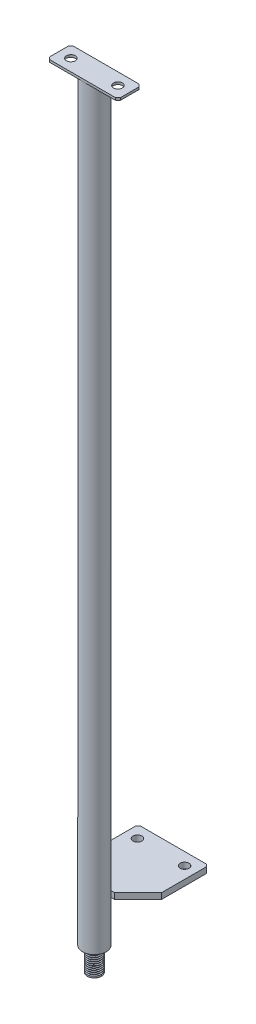
from build123d import *

# Parameters (mm, degrees)
SKETCH1_R           = 12.7
SKETCH1_R_2         = 7.62
BOSS_EXTRUDE1_DEPTH = 812.8
BOSS_EXTRUDE2_START = 38.1
SKETCH2_R           = 7.62
BOSS_EXTRUDE2_DEPTH = 38.1
THREAD1_PITCH       = 1.953846154
BOSS_EXTRUDE4_START = 6.35
BOSS_EXTRUDE4_DEPTH = 6.35
CUT_EXTRUDE2_REACH  = 769.692
SKETCH11_R          = 4.7625
SKETCH12_W          = 76.2
SKETCH12_H          = 25.4
BOSS_EXTRUDE5_DEPTH = 2.54
CUT_EXTRUDE3_REACH  = 847.902
SKETCH13_R          = 4.7625
CHAMFER1_SIZE       = 2.54


with BuildPart() as part:
    # Sketch1 → Boss-Extrude1 (new body)
    with BuildSketch(Plane(origin=(0, 0, 0), x_dir=(1, 0, 0), z_dir=(0, 1, 0))):
        with Locations(Location((0, 0, 0), (0, 0, 270))):
            Circle(SKETCH1_R)
        with Locations(Location((0, 0, 0), (0, 0, 270))):
            Circle(SKETCH1_R_2, mode=Mode.SUBTRACT)
    extrude(amount=BOSS_EXTRUDE1_DEPTH)

    # Sketch2 → Boss-Extrude2 (add)
    with BuildSketch(Plane(origin=(0, 12.7, 0), x_dir=(-1, 0, 0), z_dir=(0, -1, 0)).offset(BOSS_EXTRUDE2_START)):
        with Locations(Location((0, 0, 0), (0, 0, 90))):
            Circle(SKETCH2_R)
    extrude(amount=-BOSS_EXTRUDE2_DEPTH)

    # Thread1: the profile of Thread Profile2 profile screwed along a right-hand helix of 19.5 turns, 10 arcs to a turn; built about Z, then put on its axis
    thread1_z = Axis((0, 0, 0), (0, 0, 1))
    thread1_corners = [(7.6203, 0, -0.000173205), (7.6203, 0, 1.709788584), (6.562449752, 0, 1.099038459), (6.562449752, 0, 0.61057692)]
    with BuildLine(mode=Mode.PRIVATE) as thread1_profile:
        Line(thread1_corners[0], thread1_corners[1])
        Line(thread1_corners[1], thread1_corners[2])
        Line(thread1_corners[2], thread1_corners[3])
        Line(thread1_corners[3], thread1_corners[0])
    thread1_cap = Face(thread1_profile.wire())
    thread1_turn_angles = [0, 18, 36, 54, 72, 90, 108, 126, 144, 162, 180, 198, 216, 234, 252, 270, 288, 306, 324, 342, 360]
    thread1_turn_weights = [1, 0.9510565162951535, 1, 0.9510565162951535, 1, 0.9510565162951535, 1, 0.9510565162951535, 1, 0.9510565162951535, 1, 0.9510565162951535, 1, 0.9510565162951535, 1, 0.9510565162951535, 1, 0.9510565162951535, 1, 0.9510565162951535, 1]
    thread1_turn_rails = [Edge.make_bspline([Vector(p[0], p[1], 0).rotate(thread1_z, thread1_turn_angles[k]) / thread1_turn_weights[k] + Vector(0, 0, p[2] + THREAD1_PITCH * thread1_turn_angles[k] / 360) for k in range(21)], [0, 0, 0, 1, 1, 2, 2, 3, 3, 4, 4, 5, 5, 6, 6, 7, 7, 8, 8, 9, 9, 10, 10, 10], 2, thread1_turn_weights) for p in thread1_corners]
    thread1_turn_sides = [Face.make_surface_from_curves(thread1_turn_rails[p[0]], thread1_turn_rails[p[1]]) for p in [(0, 1), (1, 2), (2, 3), (3, 0)]]
    thread1_last_angles = [6840, 6858, 6876, 6894, 6912, 6930, 6948, 6966, 6984, 7002, 7020]
    thread1_last_weights = [1, 0.9510565162951535, 1, 0.9510565162951535, 1, 0.9510565162951535, 1, 0.9510565162951535, 1, 0.951056516295156, 1]
    thread1_last_rails = [Edge.make_bspline([Vector(p[0], p[1], 0).rotate(thread1_z, thread1_last_angles[k]) / thread1_last_weights[k] + Vector(0, 0, p[2] + THREAD1_PITCH * thread1_last_angles[k] / 360) for k in range(11)], [0, 0, 0, 1, 1, 2, 2, 3, 3, 4, 4, 5, 5, 5], 2, thread1_last_weights) for p in thread1_corners]
    thread1_last_sides = [Face.make_surface_from_curves(thread1_last_rails[p[0]], thread1_last_rails[p[1]]) for p in [(0, 1), (1, 2), (2, 3), (3, 0)]]
    thread1 = Plane(origin=(0, -25.4, 0), x_dir=(1, 0, 0), z_dir=(0, 1, 0)) * Solid(Shell([*[p.moved(Location((0, 0, THREAD1_PITCH * i))) for i in range(19) for p in thread1_turn_sides], *thread1_last_sides, thread1_cap, thread1_cap.rotate(thread1_z, 7020).moved(Location((0, 0, THREAD1_PITCH * 7020 / 360)))]))
    add(thread1, mode=Mode.SUBTRACT)

    # Sketch10 → Boss-Extrude4 (add)
    with BuildSketch(Plane(origin=(0, 50.8, 0), x_dir=(-1, 0, 0), z_dir=(0, -1, 0)).offset(BOSS_EXTRUDE4_START)):
        with BuildLine():
            Line((-8.980256121, 8.980256121), (-12.7, 8.980256121))
            Line((-12.7, 8.980256121), (-38.1, 34.380256121))
            Line((-38.1, 34.380256121), (-38.1, 85.180256121))
            Line((-38.1, 85.180256121), (38.1, 85.180256121))
            Line((38.1, 85.180256121), (38.1, 34.380256121))
            Line((38.1, 34.380256121), (12.7, 8.980256121))
            Line((12.7, 8.980256121), (8.980256121, 8.980256121))
            ThreePointArc((8.980256121, 8.980256121), (0, 12.7), (-8.980256121, 8.980256121))
        make_face()
    extrude(amount=-BOSS_EXTRUDE4_DEPTH)

    # Sketch11 → Cut-Extrude2 (cut, up to next)
    with BuildSketch(Plane(origin=(0, 50.8, 0), x_dir=(1, 0, 0), z_dir=(0, 1, 0)), mode=Mode.PRIVATE) as cut_extrude2_sk1:
        with Locations(Location((-25.4, 71.842048969, 0), (0, 0, 270))):
            Circle(SKETCH11_R)
    cut_extrude2_tool1 = extrude(cut_extrude2_sk1.sketch, amount=-CUT_EXTRUDE2_REACH, mode=Mode.PRIVATE) & part.part
    # Sketch11 → Cut-Extrude2 (cut, up to next)
    with BuildSketch(Plane(origin=(0, 50.8, 0), x_dir=(1, 0, 0), z_dir=(0, 1, 0)), mode=Mode.PRIVATE) as cut_extrude2_sk2:
        with Locations(Location((25.4, 71.842048969, 0), (0, 0, 270))):
            Circle(SKETCH11_R)
    cut_extrude2_tool2 = extrude(cut_extrude2_sk2.sketch, amount=-CUT_EXTRUDE2_REACH, mode=Mode.PRIVATE) & part.part
    add(cut_extrude2_tool1.solids().sort_by_distance((-25.4, 50.8, -71.842049))[0], mode=Mode.SUBTRACT)
    add(cut_extrude2_tool2.solids().sort_by_distance((25.4, 50.8, -71.842049))[0], mode=Mode.SUBTRACT)

    # Sketch12 → Boss-Extrude5 (add)
    with BuildSketch(Plane(origin=(0, 812.8, 0), x_dir=(1, 0, 0), z_dir=(0, 1, 0))):
        Rectangle(SKETCH12_W, SKETCH12_H)
    extrude(amount=BOSS_EXTRUDE5_DEPTH)

    # Sketch13 → Cut-Extrude3 (cut, up to next)
    with BuildSketch(Plane(origin=(0, 815.34, 0), x_dir=(1, 0, 0), z_dir=(0, 1, 0)), mode=Mode.PRIVATE) as cut_extrude3_sk1:
        with Locations(Location((-25.4, 0, 0), (0, 0, 270))):
            Circle(SKETCH13_R)
    cut_extrude3_tool1 = extrude(cut_extrude3_sk1.sketch, amount=-CUT_EXTRUDE3_REACH, mode=Mode.PRIVATE) & part.part
    # Sketch13 → Cut-Extrude3 (cut, up to next)
    with BuildSketch(Plane(origin=(0, 815.34, 0), x_dir=(1, 0, 0), z_dir=(0, 1, 0)), mode=Mode.PRIVATE) as cut_extrude3_sk2:
        with Locations(Location((25.4, 0, 0), (0, 0, 270))):
            Circle(SKETCH13_R)
    cut_extrude3_tool2 = extrude(cut_extrude3_sk2.sketch, amount=-CUT_EXTRUDE3_REACH, mode=Mode.PRIVATE) & part.part
    add(cut_extrude3_tool1.solids().sort_by_distance((-25.4, 815.34, 0))[0], mode=Mode.SUBTRACT)
    add(cut_extrude3_tool2.solids().sort_by_distance((25.4, 815.34, 0))[0], mode=Mode.SUBTRACT)

    # Chamfer1
    chamfer1_edges = [part.edges().sort_by_distance(p)[0] for p in [
        (-38.1, 814.07, -12.7),
        (-38.1, 814.07, 12.7),
        (38.1, 814.07, 12.7),
        (38.1, 814.07, -12.7),
        (-38.1, 47.625, -85.180256121),
        (38.1, 47.625, -85.180256121),
    ]]
    chamfer(chamfer1_edges, length=CHAMFER1_SIZE)


solid = part.part
